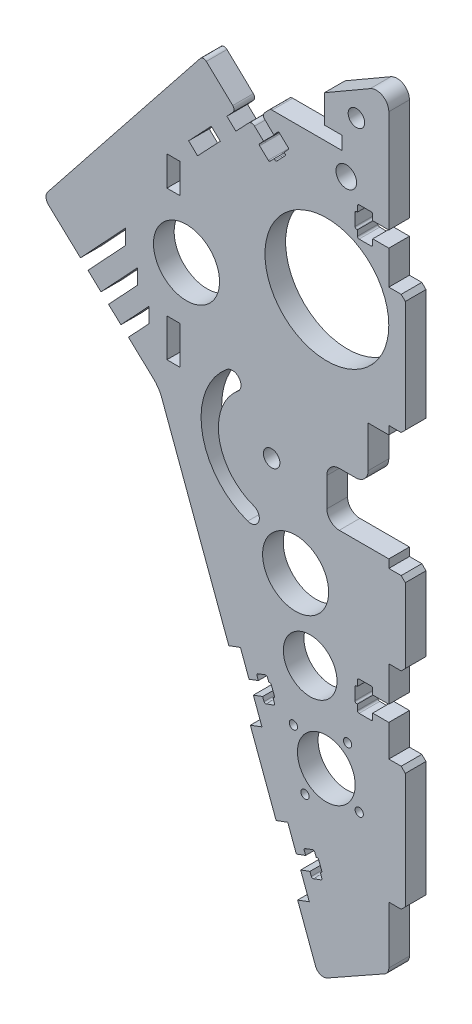
from build123d import *

# Parameters (mm, degrees)
SKETCH_1_R           = 1.5
SKETCH_1_R_2         = 2
SKETCH_1_W           = 3
SKETCH_1_H           = 10
SKETCH_1_H_2         = 7
EXTRUDE_1_DEPTH      = 5
EXTRUDE_2_DEPTH      = 5
SKETCH_3_W           = 3
SKETCH_3_H           = 5
CUT_EXTRUDE_1_DEPTH  = 6
CUT_EXTRUDE_2_DEPTH  = 5
SKETCH_5_W           = 3
SKETCH_5_H           = 5
EXTRUDE_3_DEPTH      = 1
FILLET_1_R           = 1
FILLET_2_R           = 2
FILLET_3_R           = 8
FILLET_4_R           = 0.5
FILLET_5_R           = 0.5
SKETCH_6_R           = 13.9
CUT_EXTRUDE_3_DEPTH  = 5
SKETCH_8_R           = 15
SKETCH_8_R_2         = 13.9
CUT_EXTRUDE_5_DEPTH  = 5
SKETCH_9_W           = 3
SKETCH_9_H           = 5
EXTRUDE_4_DEPTH      = 5
SKETCH_10_R          = 2.5
CUT_EXTRUDE_6_DEPTH  = 7
CUT_EXTRUDE_7_DEPTH  = 7
SKETCH_13_W          = 3
SKETCH_13_H          = 10
CUT_EXTRUDE_9_DEPTH  = 5
CUT_EXTRUDE_11_DEPTH = 102.030456202
SKETCH_16_R          = 1.5
EXTRUDE_5_DEPTH      = 5
SKETCH_17_R          = 10.5
SKETCH_17_R_2        = 2
CUT_EXTRUDE_12_DEPTH = 10
SKETCH_18_W          = 3
SKETCH_18_H          = 10
EXTRUDE_6_DEPTH      = 5
SKETCH_25_R          = 10.5
SKETCH_25_R_2        = 2.5
EXTRUDE_7_DEPTH      = 5
EXTRUDE_8_DEPTH      = 5
SKETCH_28_R          = 8
SKETCH_28_R_2        = 2.5
CUT_EXTRUDE_14_DEPTH = 102.030456202
SKETCH_29_R          = 3
CUT_EXTRUDE_15_DEPTH = 10
SKETCH_32_R          = 2
CUT_EXTRUDE_18_DEPTH = 10
SKETCH_33_R          = 6.5
SKETCH_33_R_2        = 3
CUT_EXTRUDE_19_DEPTH = 10
SKETCH_34_R          = 6.5
SKETCH_34_R_2        = 2
CUT_EXTRUDE_20_DEPTH = 5
SKETCH_35_R          = 1.05
CUT_EXTRUDE_21_DEPTH = 5
SKETCH_36_R          = 2.5
SKETCH_36_R_2        = 1.05
CUT_EXTRUDE_22_DEPTH = 5
SKETCH_37_R          = 2.5
SKETCH_37_R_2        = 2
EXTRUDE_9_DEPTH      = 5
CUT_EXTRUDE_23_DEPTH = 5
SKETCH_39_R          = 8.5
SKETCH_39_R_2        = 6.5
SKETCH_39_R_3        = 8
CUT_EXTRUDE_25_DEPTH = 102.030456202
EXTRUDE_START        = -5
SKETCH_40_R          = 1.5
EXTRUDE_10_DEPTH     = 5
SKETCH_41_R          = 2.5
CUT_EXTRUDE_26_DEPTH = 224.315111886
SKETCH_42_R          = 8.5
EXTRUDE_11_DEPTH     = 5
SKETCH_44_R          = 6.95
CUT_EXTRUDE_28_DEPTH = 10
SKETCH_46_R          = 6.5
CUT_EXTRUDE_29_DEPTH = 10
SKETCH_47_R          = 6.5
SKETCH_47_R_2        = 8
SKETCH_47_R_3        = 7
CUT_EXTRUDE_30_DEPTH = 102.030456202
SKETCH_50_W          = 5
SKETCH_50_H          = 26
CUT_EXTRUDE_31_DEPTH = 10
SKETCH_51_R          = 1
CUT_EXTRUDE_32_DEPTH = 10
CUT_EXTRUDE_33_DEPTH = 5
SKETCH_54_W          = 3
SKETCH_54_H          = 5
EXTRUDE_12_DEPTH     = 2
CUT_EXTRUDE_34_DEPTH = 10
FILLET_8_R           = 3
FILLET_9_R           = 3
CUT_EXTRUDE_35_DEPTH = 5
CUT_EXTRUDE_36_DEPTH = 5
EXTRUDE_13_DEPTH     = 5
SKETCH_59_R          = 2
CUT_EXTRUDE_37_DEPTH = 5
SKETCH_60_W          = 5
SKETCH_60_H          = 29
SKETCH_60_H_2        = 20
SKETCH_60_H_3        = 30
EXTRUDE_14_DEPTH     = 1
CHAMFER_1_SIZE       = 1
SKETCH_61_W          = 4.23427564
SKETCH_61_H          = 5
CUT_EXTRUDE_38_DEPTH = 0.2
SKETCH_63_W          = 3.2
SKETCH_63_H          = 7.2
SKETCH_63_W_2        = 3
SKETCH_63_H_2        = 7
SKETCH_63_H_3        = 9.2
SKETCH_63_H_4        = 9
CUT_EXTRUDE_39_DEPTH = 9
CUT_EXTRUDE_START    = -9
CUT_EXTRUDE_40_DEPTH = 9
SKETCH_65_R          = 6.5
EXTRUDE_15_DEPTH     = 5
SKETCH_66_R          = 6.5
CUT_EXTRUDE_41_DEPTH = 10


with BuildPart() as part:
    # 草图1 → 凸台-拉伸1 (new body)
    with BuildSketch(Plane.XY):
        with BuildLine():
            Line((24.110066786, 85.258646967), (24.110066786, 81.258646967))
            Line((24.110066786, 81.258646967), (25.510066786, 81.258646967))
            ThreePointArc((25.510066786, 81.258646967), (25.72219882, 81.170779001), (25.810066786, 80.958646967))
            Line((25.810066786, 80.958646967), (25.810066786, 78.058646967))
            ThreePointArc((25.810066786, 78.058646967), (25.72219882, 77.846514932), (25.510066786, 77.758646967))
            Line((25.510066786, 77.758646967), (24.060066786, 77.758646967))
            Line((24.060066786, 77.758646967), (24.060066786, 77.458646967))
            ThreePointArc((24.060066786, 77.458646967), (23.97219882, 77.246514932), (23.760066786, 77.158646967))
            Line((23.760066786, 77.158646967), (20.860066786, 77.158646967))
            ThreePointArc((20.860066786, 77.158646967), (20.647934752, 77.246514932), (20.560066786, 77.458646967))
            Line((20.560066786, 77.458646967), (20.560066786, 77.758646967))
            Line((20.560066786, 77.758646967), (19.110066786, 77.758646967))
            ThreePointArc((19.110066786, 77.758646967), (18.897934752, 77.846514932), (18.810066786, 78.058646967))
            Line((18.810066786, 78.058646967), (18.810066786, 80.958646967))
            ThreePointArc((18.810066786, 80.958646967), (18.897934752, 81.170779001), (19.110066786, 81.258646967))
            Line((19.110066786, 81.258646967), (20.510066786, 81.258646967))
            Line((20.510066786, 81.258646967), (20.510066786, 85.258646967))
            Line((20.510066786, 85.258646967), (11.664253751, 85.258646967))
            Line((11.664253751, 85.258646967), (9.598297328, 83.074863264))
            Line((9.598297328, 83.074863264), (12.504028119, 80.325912815))
            Line((12.504028119, 80.325912815), (13.466160776, 81.342918592))
            ThreePointArc((13.466160776, 81.342918592), (13.675776052, 81.436632067), (13.890261869, 81.354677117))
            Line((13.890261869, 81.354677117), (15.996916692, 79.361688042))
            ThreePointArc((15.996916692, 79.361688042), (16.090630167, 79.152072766), (16.008675218, 78.937586949))
            Line((16.008675218, 78.937586949), (15.01218068, 77.884259537))
            Line((15.01218068, 77.884259537), (15.230110489, 77.678088254))
            ThreePointArc((15.230110489, 77.678088254), (15.323823965, 77.468472977), (15.241869015, 77.253987161))
            Line((15.241869015, 77.253987161), (13.24887994, 75.147332337))
            ThreePointArc((13.24887994, 75.147332337), (13.039264663, 75.053618862), (12.824778847, 75.135573812))
            Line((12.824778847, 75.135573812), (12.606849037, 75.341745095))
            Line((12.606849037, 75.341745095), (11.610354499, 74.288417684))
            ThreePointArc((11.610354499, 74.288417684), (11.400739223, 74.194704209), (11.186253406, 74.276659158))
            Line((11.186253406, 74.276659158), (9.079598583, 76.269648234))
            ThreePointArc((9.079598583, 76.269648234), (8.985885108, 76.47926351), (9.067840058, 76.693749327))
            Line((9.067840058, 76.693749327), (10.029972715, 77.710755103))
            Line((10.029972715, 77.710755103), (7.124241924, 80.459705553))
            Line((7.124241924, 80.459705553), (3.33493389, 76.454282671))
            Line((3.33493389, 76.454282671), (1.155635797, 78.515995507))
            Line((1.155635797, 78.515995507), (3.288183972, 80.770168877))
            Line((3.288183972, 80.770168877), (-4.627382992, 88.258646967))
            Line((-4.627382992, 88.258646967), (-43.372617008, 39.51341295))
            Line((-43.372617008, 39.51341295), (-15.278493909, 13.299105295))
            Line((-15.278493909, 13.299105295), (23.442000691, -91.258646967))
            Line((23.442000691, -91.258646967), (40.372617008, -81.741353033))
            Line((40.372617008, -81.741353033), (40.372617008, -66.741353033))
            Line((40.372617008, -66.741353033), (43.372617008, -66.741353033))
            Line((43.372617008, -66.741353033), (43.372617008, -36.741353033))
            Line((43.372617008, -36.741353033), (40.372617008, -36.741353033))
            Line((40.372617008, -36.741353033), (40.372617008, -16.741353033))
            Line((40.372617008, -16.741353033), (43.372617008, -16.741353033))
            Line((43.372617008, -16.741353033), (43.372617008, 3.258646967))
            Line((43.372617008, 3.258646967), (40.372617008, 3.258646967))
            Line((40.372617008, 3.258646967), (40.372617008, 33.258646967))
            Line((40.372617008, 33.258646967), (43.372617008, 33.258646967))
            Line((43.372617008, 33.258646967), (43.372617008, 63.258646967))
            Line((43.372617008, 63.258646967), (40.372617008, 63.258646967))
            Line((40.372617008, 63.258646967), (40.372617008, 91.258646967))
            Line((40.372617008, 91.258646967), (26.01843538, 89.258646967))
            Line((26.01843538, 89.258646967), (26.01843538, 88.258646967))
            Line((26.01843538, 88.258646967), (29.01843538, 88.258646967))
            Line((29.01843538, 88.258646967), (29.01843538, 85.258646967))
            Line((29.01843538, 85.258646967), (24.110066786, 85.258646967))
        make_face()
        with Locations((-0.627382992, 42.90511504)):
            Circle(SKETCH_1_R, mode=Mode.SUBTRACT)
        with Locations((-16.627382992, 42.90511504)):
            Circle(SKETCH_1_R, mode=Mode.SUBTRACT)
        with Locations((-8.627382992, 42.90511504)):
            Circle(SKETCH_1_R_2, mode=Mode.SUBTRACT)
        with Locations((-8.627382992, 33.40511504)):
            Circle(SKETCH_1_R, mode=Mode.SUBTRACT)
        with Locations((-8.627382992, 52.40511504)):
            Circle(SKETCH_1_R, mode=Mode.SUBTRACT)
        with Locations((-3.334138896, -7.554104516)):
            Circle(SKETCH_1_R, mode=Mode.SUBTRACT)
        with Locations((17.428516218, -66.946668999)):
            Circle(SKETCH_1_R, mode=Mode.SUBTRACT)
        with Locations((7.903198422, -39.393226917)):
            Circle(SKETCH_1_R, mode=Mode.SUBTRACT)
        with Locations((-11.778493909, 25.258646967)):
            Rectangle(SKETCH_1_W, SKETCH_1_H, mode=Mode.SUBTRACT)
        with Locations((-11.778493909, 59.758646967)):
            Rectangle(SKETCH_1_W, SKETCH_1_H_2, mode=Mode.SUBTRACT)
        Polygon((0.058370516, 10.169444748), (8.447755551, 4.727182468), (6.815076867, 2.210366957), (-1.574308168, 7.652629238), align=None, mode=Mode.SUBTRACT)
        Polygon((31.983231973, -14.116419884), (19.39915442, -5.953026463), (21.031833104, -3.436210953), (33.615910657, -11.599604373), align=None, mode=Mode.SUBTRACT)
        with BuildLine():
            Line((31.674388164, 21.897928134), (31.674388164, -0.348192949))
            ThreePointArc((31.674388164, -0.348192949), (30.106513149, -2.984291966), (27.04170948, -2.86500846))
            Line((27.04170948, -2.86500846), (3.74702829, 12.24644062))
            ThreePointArc((3.74702829, 12.24644062), (2.743607957, 13.331131145), (2.379706974, 14.763256131))
            Line((2.379706974, 14.763256131), (2.379706974, 24.319098404))
            ThreePointArc((2.379706974, 24.319098404), (3.5219981, 26.674712494), (6.078985468, 27.236461869))
            Line((6.078985468, 27.236461869), (23.008916273, 23.178435961))
            ThreePointArc((23.008916273, 23.178435961), (24.06434878, 23.117015392), (25.075550509, 23.4255301))
            Line((25.075550509, 23.4255301), (27.307032423, 24.568197461))
            ThreePointArc((27.307032423, 24.568197461), (30.239305538, 24.457426838), (31.674388164, 21.897928134))
        make_face(mode=Mode.SUBTRACT)
    extrude(amount=EXTRUDE_1_DEPTH)

    # 草图2 → 凸台-拉伸2 (add)
    with BuildSketch(Plane.XY.offset(5)):
        Polygon((16.087160268, 85.258646967), (19.940350763, 70.440732915), (29.778501441, 72.999005864), (25.938529583, 85.258646967), align=None)
    extrude(amount=-EXTRUDE_2_DEPTH)

    # 草图3 → 切除-拉伸1 (cut)
    with BuildSketch(Plane(origin=(0, 63.258646967, 0), x_dir=(1, 0, 0), z_dir=(0, 1, 0))):
        with Locations((41.872617008, -2.5)):
            Rectangle(SKETCH_3_W, SKETCH_3_H)
    extrude(amount=-CUT_EXTRUDE_1_DEPTH, mode=Mode.SUBTRACT)

    # 草图4 → 切除-拉伸2 (cut)
    with BuildSketch(Plane(origin=(247.872617008, 71.662583046, 0), x_dir=(-1, 0, 0), z_dir=(0, 0, -1))):
        with BuildLine():
            Line((211.5, -1.116596528), (211.5, -2.516596528))
            ThreePointArc((211.5, -2.516596528), (211.587867966, -2.728728563), (211.8, -2.816596528))
            Line((211.8, -2.816596528), (214.7, -2.816596528))
            ThreePointArc((214.7, -2.816596528), (214.912132034, -2.728728563), (215, -2.516596528))
            Line((215, -2.516596528), (215, -1.066596528))
            Line((215, -1.066596528), (215.3, -1.066596528))
            ThreePointArc((215.3, -1.066596528), (215.512132034, -0.978728563), (215.6, -0.766596528))
            Line((215.6, -0.766596528), (215.6, 2.133403472))
            ThreePointArc((215.6, 2.133403472), (215.512132034, 2.345535506), (215.3, 2.433403472))
            Line((215.3, 2.433403472), (215, 2.433403472))
            Line((215, 2.433403472), (215, 3.883403472))
            ThreePointArc((215, 3.883403472), (214.912132034, 4.095535506), (214.7, 4.183403472))
            Line((214.7, 4.183403472), (211.8, 4.183403472))
            ThreePointArc((211.8, 4.183403472), (211.587867966, 4.095535506), (211.5, 3.883403472))
            Line((211.5, 3.883403472), (211.5, 2.483403472))
            Line((211.5, 2.483403472), (207.5, 2.483403472))
            Line((207.5, 2.483403472), (207.5, -1.116596528))
            Line((207.5, -1.116596528), (211.5, -1.116596528))
        make_face()
        with BuildLine():
            Line((215, -102.00737607), (215, -100.55737607))
            Line((215, -100.55737607), (215.3, -100.55737607))
            ThreePointArc((215.3, -100.55737607), (215.512132034, -100.469508105), (215.6, -100.25737607))
            Line((215.6, -100.25737607), (215.6, -97.35737607))
            ThreePointArc((215.6, -97.35737607), (215.512132034, -97.145244036), (215.3, -97.05737607))
            Line((215.3, -97.05737607), (215, -97.05737607))
            Line((215, -97.05737607), (215, -95.60737607))
            ThreePointArc((215, -95.60737607), (214.912132034, -95.395244036), (214.7, -95.30737607))
            Line((214.7, -95.30737607), (211.8, -95.30737607))
            ThreePointArc((211.8, -95.30737607), (211.587867966, -95.395244036), (211.5, -95.60737607))
            Line((211.5, -95.60737607), (211.5, -97.00737607))
            Line((211.5, -97.00737607), (207.5, -97.00737607))
            Line((207.5, -97.00737607), (207.5, -100.60737607))
            Line((207.5, -100.60737607), (211.5, -100.60737607))
            Line((211.5, -100.60737607), (211.5, -102.00737607))
            ThreePointArc((211.5, -102.00737607), (211.587867966, -102.219508105), (211.8, -102.30737607))
            Line((211.8, -102.30737607), (214.7, -102.30737607))
            ThreePointArc((214.7, -102.30737607), (214.912132034, -102.219508105), (215, -102.00737607))
        make_face()
    extrude(amount=-CUT_EXTRUDE_2_DEPTH, mode=Mode.SUBTRACT)

    # 草图5 → 凸台-拉伸3 (add)
    with BuildSketch(Plane.XZ.offset(-30.258646967)):
        with Locations((-11.778493909, 2.5)):
            Rectangle(SKETCH_5_W, SKETCH_5_H)
    extrude(amount=EXTRUDE_3_DEPTH)

    # 圆角1
    fillet_1_edges = [part.edges().sort_by_distance(p)[0] for p in [
        (40.372617008, 91.258646967, 2.5),
        (-4.627382992, 88.258646967, 2.5),
        (3.288183972, 80.770168877, 2.5),
        (7.124241924, 80.459705553, 2.5),
        (9.598297328, 83.074863264, 2.5),
        (11.664253751, 85.258646967, 2.5),
    ]]
    fillet(fillet_1_edges, radius=FILLET_1_R)

    # 圆角2
    fillet_2_edges = [part.edges().sort_by_distance(p)[0] for p in [
        (40.372617008, -81.741353033, 2.5),
        (23.442000691, -91.258646967, 2.5),
        (-43.372617008, 39.51341295, 2.5),
    ]]
    fillet(fillet_2_edges, radius=FILLET_2_R)

    # 圆角3
    fillet_3_edges = [part.edges().sort_by_distance(p)[0] for p in [
        (-15.278493909, 13.299105295, 2.5),
    ]]
    fillet(fillet_3_edges, radius=FILLET_3_R)

    # 圆角4
    fillet_4_edges = [part.edges().sort_by_distance(p)[0] for p in [
        (26.01843538, 88.258646967, 2.5),
    ]]
    fillet(fillet_4_edges, radius=FILLET_4_R)

    # 圆角5
    fillet_5_edges = [part.edges().sort_by_distance(p)[0] for p in [
        (26.01843538, 89.258646967, 2.5),
    ]]
    fillet(fillet_5_edges, radius=FILLET_5_R)

    # 草图6 → 切除-拉伸3 (cut)
    with BuildSketch(Plane(origin=(151.993359174, -9.113805438, 5), x_dir=(1, 0, 0), z_dir=(0, 0, 1))):
        with Locations((-126.620742166, 63.372452405)):
            Circle(SKETCH_6_R)
    extrude(amount=-CUT_EXTRUDE_3_DEPTH, mode=Mode.SUBTRACT)

    # 草图8 → 切除-拉伸5 (cut)
    with BuildSketch(Plane.XY.offset(5)):
        with Locations((25.372617008, 54.258646967)):
            Circle(SKETCH_8_R)
        with Locations((25.372617008, 54.258646967)):
            Circle(SKETCH_8_R_2, mode=Mode.SUBTRACT)
    extrude(amount=-CUT_EXTRUDE_5_DEPTH, mode=Mode.SUBTRACT)

    # 草图9 → 凸台-拉伸4 (add)
    with BuildSketch(Plane(origin=(0, 57.258646967, 0), x_dir=(1, 0, 0), z_dir=(0, 1, 0))):
        with Locations((41.872617008, -2.5)):
            Rectangle(SKETCH_9_W, SKETCH_9_H)
    extrude(amount=EXTRUDE_4_DEPTH)

    # 草图10 → 切除-拉伸6 (cut)
    with BuildSketch(Plane.XY.offset(5)):
        with Locations((-3.086107777, 36.571790662)):
            Circle(SKETCH_10_R)
    extrude(amount=-CUT_EXTRUDE_6_DEPTH, mode=Mode.SUBTRACT)

    # 草图11 → 切除-拉伸7 (cut)
    with BuildSketch(Plane(origin=(151.993359174, -9.113805438, 0), x_dir=(-1, 0, 0), z_dir=(0, 0, -1))):
        Polygon((186.315755954, 40.18256053), (175.400193761, 51.880872459), (175.400193761, 48.216379574), (184.487894715, 38.477003937), align=None)
        Polygon((181.336500663, 35.536473886), (172.467606381, 45.041352329), (172.467606381, 41.376859443), (179.508639424, 33.830917294), align=None)
        Polygon((174.688206133, 29.333025657), (169.693841001, 34.68553432), (169.693841001, 38.350027206), (176.516067372, 31.03858225), align=None)
    extrude(amount=-CUT_EXTRUDE_7_DEPTH, mode=Mode.SUBTRACT)

    # 草图13 → 切除-拉伸9 (cut)
    with BuildSketch(Plane(origin=(151.993359174, -9.113805438, 5), x_dir=(1, 0, 0), z_dir=(0, 0, 1))):
        with Locations((-131.120742166, -13.297143687)):
            Rectangle(SKETCH_13_W, SKETCH_13_H)
        with Locations((-131.120742166, -34.297143687)):
            Rectangle(SKETCH_13_W, SKETCH_13_H)
    extrude(amount=-CUT_EXTRUDE_9_DEPTH, mode=Mode.SUBTRACT)

    # 草图15 → 切除-拉伸11 (cut, through all)
    with BuildSketch(Plane(origin=(0, 0, 0), x_dir=(-1, 0, 0), z_dir=(0, 0, -1))):
        with BuildLine():
            Line((1.38875013, 38.407267989), (-2.408722843, 34.895554883))
            ThreePointArc((-2.408722843, 34.895554883), (-2.074657304, 29.412918204), (3.232514572, 30.828838897))
            Line((3.232514572, 30.828838897), (5.363967741, 35.541570304))
            ThreePointArc((5.363967741, 35.541570304), (4.548059056, 38.599769572), (1.38875013, 38.407267989))
        make_face()
    extrude(amount=-CUT_EXTRUDE_11_DEPTH, mode=Mode.SUBTRACT)

    # 草图16 → 凸台-拉伸5 (add)
    with BuildSketch(Plane(origin=(0, 0, 0), x_dir=(-1, 0, 0), z_dir=(0, 0, -1))):
        with Locations((8.627382992, 52.40511504)):
            Circle(SKETCH_16_R)
        with Locations((16.627382992, 42.90511504)):
            Circle(SKETCH_16_R)
        with Locations((0.627382992, 42.90511504)):
            Circle(SKETCH_16_R)
        with Locations((8.627382992, 33.40511504)):
            Circle(SKETCH_16_R)
        with BuildLine():
            Line((1.38875013, 38.407267989), (-2.408722843, 34.895554883))
            ThreePointArc((-2.408722843, 34.895554883), (-2.074657304, 29.412918204), (3.232514572, 30.828838897))
            Line((3.232514572, 30.828838897), (5.363967741, 35.541570304))
            ThreePointArc((5.363967741, 35.541570304), (4.548059056, 38.599769572), (1.38875013, 38.407267989))
        make_face()
        with BuildLine():
            Line((-2.379706974, 24.319098404), (-2.379706974, 14.763256131))
            ThreePointArc((-2.379706974, 14.763256131), (-2.743607957, 13.331131145), (-3.74702829, 12.24644062))
            Line((-3.74702829, 12.24644062), (-27.04170948, -2.86500846))
            ThreePointArc((-27.04170948, -2.86500846), (-30.106513149, -2.984291966), (-31.674388164, -0.348192949))
            Line((-31.674388164, -0.348192949), (-31.674388164, 21.897928134))
            ThreePointArc((-31.674388164, 21.897928134), (-30.239305538, 24.457426838), (-27.307032423, 24.568197461))
            Line((-27.307032423, 24.568197461), (-25.075550509, 23.4255301))
            ThreePointArc((-25.075550509, 23.4255301), (-24.06434878, 23.117015392), (-23.008916273, 23.178435961))
            Line((-23.008916273, 23.178435961), (-6.078985468, 27.236461869))
            ThreePointArc((-6.078985468, 27.236461869), (-3.5219981, 26.674712494), (-2.379706974, 24.319098404))
        make_face()
    extrude(amount=-EXTRUDE_5_DEPTH)

    # 草图17 → 切除-拉伸12 (cut)
    with BuildSketch(Plane(origin=(0, 0, 0), x_dir=(-1, 0, 0), z_dir=(0, 0, -1))):
        with Locations((8.627382992, 42.90511504)):
            Circle(SKETCH_17_R)
        with Locations((8.627382992, 42.90511504)):
            Circle(SKETCH_17_R_2, mode=Mode.SUBTRACT)
    extrude(amount=-CUT_EXTRUDE_12_DEPTH, mode=Mode.SUBTRACT)

    # 草图18 → 凸台-拉伸6 (add)
    with BuildSketch(Plane(origin=(0, 0, 0), x_dir=(-1, 0, 0), z_dir=(0, 0, -1))):
        with Locations((-20.872617008, -22.410949125)):
            Rectangle(SKETCH_18_W, SKETCH_18_H)
        with Locations((-20.872617008, -43.410949125)):
            Rectangle(SKETCH_18_W, SKETCH_18_H)
    extrude(amount=-EXTRUDE_6_DEPTH)

    # 草图25 → 凸台-拉伸7 (add)
    with BuildSketch(Plane(origin=(0, 0, 0), x_dir=(-1, 0, 0), z_dir=(0, 0, -1))):
        with Locations((8.627382992, 42.90511504)):
            Circle(SKETCH_25_R)
        with Locations((8.627382992, 42.90511504)):
            Circle(SKETCH_25_R_2, mode=Mode.SUBTRACT)
    extrude(amount=-EXTRUDE_7_DEPTH)

    # 草图26 → 凸台-拉伸8 (add)
    with BuildSketch(Plane.XY.offset(5)):
        Polygon((19.39915442, -5.953026463), (31.983231973, -14.116419884), (33.615910657, -11.599604373), (21.031833104, -3.436210953), align=None)
        Polygon((8.447755551, 4.727182468), (0.058370516, 10.169444748), (-1.574308168, 7.652629238), (6.815076867, 2.210366957), align=None)
    extrude(amount=-EXTRUDE_8_DEPTH)

    # 草图28 → 切除-拉伸14 (cut, through all)
    with BuildSketch(Plane(origin=(0, 0, 0), x_dir=(-1, 0, 0), z_dir=(0, 0, -1))):
        with Locations((8.627382992, 42.90511504)):
            Circle(SKETCH_28_R)
        with Locations((8.627382992, 42.90511504)):
            Circle(SKETCH_28_R_2, mode=Mode.SUBTRACT)
    extrude(amount=-CUT_EXTRUDE_14_DEPTH, mode=Mode.SUBTRACT)

    # 草图29 → 切除-拉伸15 (cut)
    with BuildSketch(Plane(origin=(151.993359174, -9.113805438, 5), x_dir=(1, 0, 0), z_dir=(0, 0, 1))):
        with Locations((-128.473440751, -29.371661781)):
            Circle(SKETCH_29_R)
    extrude(amount=-CUT_EXTRUDE_15_DEPTH, mode=Mode.SUBTRACT)

    # 草图32 → 切除-拉伸18 (cut)
    with BuildSketch(Plane(origin=(151.993359174, -9.113805438, 5), x_dir=(1, 0, 0), z_dir=(0, 0, 1))):
        with Locations((-134.195557296, 0.077572203)):
            Circle(SKETCH_32_R)
    extrude(amount=-CUT_EXTRUDE_18_DEPTH, mode=Mode.SUBTRACT)

    # 草图33 → 切除-拉伸19 (cut)
    with BuildSketch(Plane.XY.offset(5)):
        with Locations((23.519918423, -38.48546722)):
            Circle(SKETCH_33_R)
        with Locations((23.519918423, -38.48546722)):
            Circle(SKETCH_33_R_2, mode=Mode.SUBTRACT)
    extrude(amount=-CUT_EXTRUDE_19_DEPTH, mode=Mode.SUBTRACT)

    # 草图34 → 切除-拉伸20 (cut)
    with BuildSketch(Plane.XY.offset(5)):
        with Locations((17.797801879, -9.036233236)):
            Circle(SKETCH_34_R)
        with Locations((17.797801879, -9.036233236)):
            Circle(SKETCH_34_R_2, mode=Mode.SUBTRACT)
    extrude(amount=-CUT_EXTRUDE_20_DEPTH, mode=Mode.SUBTRACT)

    # 草图35 → 切除-拉伸21 (cut)
    with BuildSketch(Plane(origin=(151.993359174, -9.113805438, 5), x_dir=(1, 0, 0), z_dir=(0, 0, 1))):
        with Locations((-139.999477336, 21.298187467)):
            Circle(SKETCH_35_R)
        with BuildLine():
            ThreePointArc((-148.576396049, 31.723467577), (-153.301600913, 18.995252745), (-144.572500517, 8.59631914))
            ThreePointArc((-144.572500517, 8.59631914), (-143.669295501, 6.67688675), (-145.588727891, 5.773681734))
            ThreePointArc((-145.588727891, 5.773681734), (-156.257628375, 18.483489473), (-150.482377985, 34.040196491))
            ThreePointArc((-150.482377985, 34.040196491), (-148.37102256, 33.834823002), (-148.576396049, 31.723467577))
        make_face()
    extrude(amount=-CUT_EXTRUDE_21_DEPTH, mode=Mode.SUBTRACT)

    # 草图36 → 切除-拉伸22 (cut)
    with BuildSketch(Plane.XY.offset(5)):
        with Locations((11.993881839, 12.184382028)):
            Circle(SKETCH_36_R)
        with Locations((11.993881839, 12.184382028)):
            Circle(SKETCH_36_R_2, mode=Mode.SUBTRACT)
    extrude(amount=-CUT_EXTRUDE_22_DEPTH, mode=Mode.SUBTRACT)

    # 草图37 → 凸台-拉伸9 (add)
    with BuildSketch(Plane.XY.offset(5)):
        with Locations((11.993881839, 12.184382028)):
            Circle(SKETCH_37_R)
        with Locations((11.993881839, 12.184382028)):
            Circle(SKETCH_37_R_2, mode=Mode.SUBTRACT)
    extrude(amount=-EXTRUDE_9_DEPTH)

    # 草图38 → 切除-拉伸23 (cut)
    with BuildSketch(Plane.XY.offset(5)):
        with BuildLine():
            ThreePointArc((3.734626782, 22.223540653), (-0.815570495, 9.966741185), (7.590229886, -0.047046731))
            ThreePointArc((7.590229886, -0.047046731), (8.794503241, -2.606289917), (6.235260055, -3.810563272))
            ThreePointArc((6.235260055, -3.810563272), (-4.756940444, 9.284390156), (1.193317533, 25.312512538))
            ThreePointArc((1.193317533, 25.312512538), (4.0084581, 25.03868122), (3.734626782, 22.223540653))
        make_face()
        with BuildLine():
            ThreePointArc((3.416963125, 22.609662139), (-1.308241739, 9.881447306), (7.420858657, -0.517486298))
            ThreePointArc((7.420858657, -0.517486298), (8.324063673, -2.436918688), (6.404631284, -3.340123704))
            ThreePointArc((6.404631284, -3.340123704), (-4.2642692, 9.369684035), (1.510981189, 24.926391053))
            ThreePointArc((1.510981189, 24.926391053), (3.622336614, 24.721017564), (3.416963125, 22.609662139))
        make_face(mode=Mode.SUBTRACT)
    extrude(amount=-CUT_EXTRUDE_23_DEPTH, mode=Mode.SUBTRACT)

    # 草图39 → 切除-拉伸25 (cut, through all)
    # profile 1 of 2: a face of its own
    with BuildSketch(Plane.XY.offset(5)):
        with Locations((23.519918423, -38.48546722)):
            Circle(SKETCH_39_R)
        with Locations((23.519918423, -38.48546722)):
            Circle(SKETCH_39_R_2, mode=Mode.SUBTRACT)
    # profile 2 of 2: a face of its own
    with BuildSketch(Plane.XY.offset(5)):
        with Locations((17.797801879, -9.036233236)):
            Circle(SKETCH_39_R_3)
        with Locations((17.797801879, -9.036233236)):
            Circle(SKETCH_39_R_2, mode=Mode.SUBTRACT)
    extrude(amount=-CUT_EXTRUDE_25_DEPTH, mode=Mode.SUBTRACT)

    # 草图40 → 凸台-拉伸10 (add)
    with BuildSketch(Plane.XY.offset(5).offset(EXTRUDE_START)):
        with Locations((17.428516218, -66.946668999)):
            Circle(SKETCH_40_R)
        with Locations((7.903198422, -39.393226917)):
            Circle(SKETCH_40_R)
        with Locations((-3.334138896, -7.554104516)):
            Circle(SKETCH_40_R)
    extrude(amount=EXTRUDE_10_DEPTH)

    # 草图41 → 切除-拉伸26 (cut, through all)
    with BuildSketch(Plane(origin=(151.993359174, -9.113805438, -39), x_dir=(-1, 0, 0), z_dir=(0, 0, -1))):
        with Locations(Location((121.921700009, 89.398624841, 0), (0, 0, 90))):
            Circle(SKETCH_41_R)
    extrude(amount=-CUT_EXTRUDE_26_DEPTH, mode=Mode.SUBTRACT)

    # 草图42 → 凸台-拉伸11 (add)
    with BuildSketch(Plane.XY.offset(5)):
        with Locations((23.519918423, -38.48546722)):
            Circle(SKETCH_42_R)
    extrude(amount=-EXTRUDE_11_DEPTH)

    # 草图44 → 切除-拉伸28 (cut)
    with BuildSketch(Plane(origin=(151.993359174, -9.113805438, 5), x_dir=(1, 0, 0), z_dir=(0, 0, 1))):
        with Locations((-126.757745003, -37.187410667)):
            Circle(SKETCH_44_R)
    extrude(amount=-CUT_EXTRUDE_28_DEPTH, mode=Mode.SUBTRACT)

    # 草图46 → 切除-拉伸29 (cut)
    with BuildSketch(Plane.XY.offset(5)):
        with Locations((22.103903732, -30.610697002)):
            Circle(SKETCH_46_R)
    extrude(amount=-CUT_EXTRUDE_29_DEPTH, mode=Mode.SUBTRACT)

    # 草图47 → 切除-拉伸30 (cut, through all)
    with BuildSketch(Plane.XY.offset(5)):
        with Locations((22.103903732, -30.610697002)):
            Circle(SKETCH_47_R)
        with Locations((17.797801879, -9.036233236)):
            Circle(SKETCH_47_R_2)
        with Locations((25.235614172, -46.301216105)):
            Circle(SKETCH_47_R_3)
    extrude(amount=-CUT_EXTRUDE_30_DEPTH, mode=Mode.SUBTRACT)

    # 草图50 → 切除-拉伸31 (cut)
    with BuildSketch(Plane(origin=(151.993359174, -9.113805438, 0), x_dir=(-1, 0, 0), z_dir=(0, 0, -1))):
        with Locations((114.120742166, 27.372452405)):
            Rectangle(SKETCH_50_W, SKETCH_50_H)
    extrude(amount=-CUT_EXTRUDE_31_DEPTH, mode=Mode.SUBTRACT)

    # 草图51 → 切除-拉伸32 (cut)
    with BuildSketch(Plane(origin=(151.993359174, -9.113805438, 5), x_dir=(1, 0, 0), z_dir=(0, 0, 1))):
        with Locations((-131.915363599, -45.165441152)):
            Circle(SKETCH_51_R)
        with Locations((-134.735775488, -32.029792071)):
            Circle(SKETCH_51_R)
        with Locations((-118.779714518, -42.345029263)):
            Circle(SKETCH_51_R)
        with Locations((-121.600126407, -29.209380182)):
            Circle(SKETCH_51_R)
    extrude(amount=-CUT_EXTRUDE_32_DEPTH, mode=Mode.SUBTRACT)

    # 草图52 → 切除-拉伸33 (cut)
    with BuildSketch(Plane(origin=(151.993359174, -9.113805438, 0), x_dir=(-1, 0, 0), z_dir=(0, 0, -1))):
        Polygon((154.617530245, 83.634421108), (152.438232152, 81.572708272), (159.310608275, 74.308381295), (161.489906368, 76.370094132), align=None)
    extrude(amount=-CUT_EXTRUDE_33_DEPTH, mode=Mode.SUBTRACT)

    # 草图54 → 凸台-拉伸12 (add)
    with BuildSketch(Plane(origin=(29.091306107, 30.750464755, 0), x_dir=(0.7264326976879513, -0.6872376122781739, 0), z_dir=(0.6872376122781739, 0.7264326976879513, 0))):
        with Locations((-51.619653649, -2.5)):
            Rectangle(SKETCH_54_W, SKETCH_54_H)
    extrude(amount=EXTRUDE_12_DEPTH)

    # 草图55 → 切除-拉伸34 (cut)
    with BuildSketch(Plane(origin=(0, 0, 0), x_dir=(-1, 0, 0), z_dir=(0, 0, -1))):
        Polygon((-35.372617008, 5.258646967), (-25.372617008, 5.258646967), (-25.372617008, 17.258646967), (-25.372617008, 18.258646967), (-35.372617008, 18.258646967), align=None)
    extrude(amount=-CUT_EXTRUDE_34_DEPTH, mode=Mode.SUBTRACT)

    # 圆角8
    fillet_8_edges = [part.edges().sort_by_distance(p)[0] for p in [
        (25.372617008, 18.258646967, 2.5),
        (25.372617008, 5.258646967, 2.5),
    ]]
    fillet(fillet_8_edges, radius=FILLET_8_R)

    # 圆角9
    fillet_9_edges = [part.edges().sort_by_distance(p)[0] for p in [
        (35.372617008, 18.258646967, 2.5),
    ]]
    fillet(fillet_9_edges, radius=FILLET_9_R)

    # 草图56 → 切除-拉伸35 (cut)
    with BuildSketch(Plane(origin=(151.993359174, -9.113805438, 5), x_dir=(1, 0, 0), z_dir=(0, 0, 1))):
        Polygon((-133.702985533, -68.233796478), (-130.889698952, -67.191962223), (-136.098870224, -53.125529319), (-138.912156804, -54.167363573), align=None)
        Polygon((-145.163162331, -37.287644088), (-142.34987575, -36.245809833), (-147.559047022, -22.179376929), (-150.372333602, -23.221211183), align=None)
    extrude(amount=-CUT_EXTRUDE_35_DEPTH, mode=Mode.SUBTRACT)

    # 草图57 → 切除-拉伸36 (cut)
    with BuildSketch(Plane(origin=(151.993359174, -9.113805438, 5), x_dir=(1, 0, 0), z_dir=(0, 0, 1))):
        with BuildLine():
            Line((-130.663689785, -60.60341763), (-133.008095269, -61.471612842))
            Line((-133.008095269, -61.471612842), (-133.980473906, -58.8458787))
            Line((-133.980473906, -58.8458787), (-131.636068422, -57.977683488))
            Line((-131.636068422, -57.977683488), (-132.000710411, -56.993033185))
            ThreePointArc((-132.000710411, -56.993033185), (-131.991979962, -56.763589164), (-131.823565179, -56.607521101))
            Line((-131.823565179, -56.607521101), (-130.041817011, -55.94769274))
            ThreePointArc((-130.041817011, -55.94769274), (-129.81237299, -55.95642319), (-129.656304927, -56.124837973))
            Line((-129.656304927, -56.124837973), (-129.274299034, -57.156376386))
            Line((-129.274299034, -57.156376386), (-129.086746595, -57.086920769))
            ThreePointArc((-129.086746595, -57.086920769), (-128.857302574, -57.095651218), (-128.701234512, -57.264066001))
            Line((-128.701234512, -57.264066001), (-127.971950534, -59.233366608))
            ThreePointArc((-127.971950534, -59.233366608), (-127.980680983, -59.462810629), (-128.149095766, -59.618878692))
            Line((-128.149095766, -59.618878692), (-128.336648205, -59.688334309))
            Line((-128.336648205, -59.688334309), (-127.954642312, -60.719872722))
            ThreePointArc((-127.954642312, -60.719872722), (-127.963372761, -60.949316742), (-128.131787544, -61.105384805))
            Line((-128.131787544, -61.105384805), (-129.913535712, -61.765213166))
            ThreePointArc((-129.913535712, -61.765213166), (-130.142979733, -61.756482717), (-130.299047796, -61.588067934))
            Line((-130.299047796, -61.588067934), (-130.663689785, -60.60341763))
        make_face()
        with BuildLine():
            Line((-142.123866583, -29.65726524), (-144.468272067, -30.525460452))
            Line((-144.468272067, -30.525460452), (-145.440650704, -27.89972631))
            Line((-145.440650704, -27.89972631), (-143.09624522, -27.031531098))
            Line((-143.09624522, -27.031531098), (-143.460887209, -26.046880794))
            ThreePointArc((-143.460887209, -26.046880794), (-143.45215676, -25.817436774), (-143.283741977, -25.661368711))
            Line((-143.283741977, -25.661368711), (-141.501993809, -25.00154035))
            ThreePointArc((-141.501993809, -25.00154035), (-141.272549788, -25.010270799), (-141.116481725, -25.178685582))
            Line((-141.116481725, -25.178685582), (-140.734475832, -26.210223995))
            Line((-140.734475832, -26.210223995), (-140.546923393, -26.140768379))
            ThreePointArc((-140.546923393, -26.140768379), (-140.317479372, -26.149498828), (-140.16141131, -26.317913611))
            Line((-140.16141131, -26.317913611), (-139.432127332, -28.287214218))
            ThreePointArc((-139.432127332, -28.287214218), (-139.440857781, -28.516658239), (-139.609272564, -28.672726301))
            Line((-139.609272564, -28.672726301), (-139.796825003, -28.742181918))
            Line((-139.796825003, -28.742181918), (-139.41481911, -29.773720331))
            ThreePointArc((-139.41481911, -29.773720331), (-139.423549559, -30.003164352), (-139.591964342, -30.159232415))
            Line((-139.591964342, -30.159232415), (-141.37371251, -30.819060776))
            ThreePointArc((-141.37371251, -30.819060776), (-141.603156531, -30.810330326), (-141.759224594, -30.641915543))
            Line((-141.759224594, -30.641915543), (-142.123866583, -29.65726524))
        make_face()
    extrude(amount=-CUT_EXTRUDE_36_DEPTH, mode=Mode.SUBTRACT)

    # 草图58 → 凸台-拉伸13 (add)
    with BuildSketch(Plane(origin=(0, 0, 0), x_dir=(-1, 0, 0), z_dir=(0, 0, -1))):
        Polygon((-40.372617008, 90.109654671), (-40.372617008, 113.720582355), (-17.846708878, 113.720582355), (-17.846708878, 88.258646967), (-29.01843538, 88.258646967), (-40.372617008, 88.258646967), align=None)
    extrude(amount=-EXTRUDE_13_DEPTH)

    # 草图59 → 切除-拉伸37 (cut)
    with BuildSketch(Plane(origin=(151.993359174, -9.113805438, 0), x_dir=(-1, 0, 0), z_dir=(0, 0, -1))):
        with Locations((119.468439353, 102.928528754)):
            Circle(SKETCH_59_R)
        with BuildLine():
            Line((127.209199434, 104.372452405), (127.209199434, 97.372452405))
            Line((127.209199434, 97.372452405), (134.146650297, 97.372452405))
            Line((134.146650297, 97.372452405), (134.146650297, 122.834387793))
            Line((134.146650297, 122.834387793), (111.620742166, 122.834387793))
            Line((111.620742166, 122.834387793), (111.620742166, 108.176299982))
            ThreePointArc((111.620742166, 108.176299982), (113.120742166, 110.774376194), (116.120742166, 110.774376194))
            Line((116.120742166, 110.774376194), (127.209199434, 104.372452405))
        make_face()
    extrude(amount=-CUT_EXTRUDE_37_DEPTH, mode=Mode.SUBTRACT)

    # 草图60 → 凸台-拉伸14 (add)
    with BuildSketch(Plane(origin=(43.372617008, 0, 0), x_dir=(0, 0, -1), z_dir=(1, 0, 0))):
        with Locations((-2.5, 47.758646967)):
            Rectangle(SKETCH_60_W, SKETCH_60_H)
        with Locations((-2.5, -6.741353033)):
            Rectangle(SKETCH_60_W, SKETCH_60_H_2)
        with Locations((-2.5, -51.741353033)):
            Rectangle(SKETCH_60_W, SKETCH_60_H_3)
    extrude(amount=EXTRUDE_14_DEPTH)

    # 倒角1
    chamfer_1_edges = [part.edges().sort_by_distance(p)[0] for p in [
        (44.372617008, 33.258646967, 2.5),
        (44.372617008, 62.258646967, 2.5),
        (44.372617008, -16.741353033, 2.5),
        (44.372617008, 3.258646967, 2.5),
        (44.372617008, -66.741353033, 2.5),
        (44.372617008, -36.741353033, 2.5),
    ]]
    chamfer(chamfer_1_edges, length=CHAMFER_1_SIZE)

    # 草图61 → 切除-拉伸38 (cut)
    with BuildSketch(Plane.XZ.offset(-88.258646967)):
        with Locations((26.90129756, 2.5)):
            Rectangle(SKETCH_61_W, SKETCH_61_H)
    extrude(amount=-CUT_EXTRUDE_38_DEPTH, mode=Mode.SUBTRACT)

    # 草图63 → 切除-拉伸39 (cut)
    # profile 1 of 5: a face of its own
    with BuildSketch(Plane(origin=(0, 0, 0), x_dir=(-1, 0, 0), z_dir=(0, 0, -1))):
        with BuildLine():
            Line((-32.872617008, 74.095986517), (-32.872617008, 75.545986517))
            ThreePointArc((-32.872617008, 75.545986517), (-32.960484974, 75.758118552), (-33.172617008, 75.845986517))
            Line((-33.172617008, 75.845986517), (-36.072617008, 75.845986517))
            ThreePointArc((-36.072617008, 75.845986517), (-36.284749043, 75.758118552), (-36.372617008, 75.545986517))
            Line((-36.372617008, 75.545986517), (-36.372617008, 74.145986517))
            Line((-36.372617008, 74.145986517), (-40.372617008, 74.145986517))
            Line((-40.372617008, 74.145986517), (-40.372617008, 74.245986517))
            Line((-40.372617008, 74.245986517), (-36.472617008, 74.245986517))
            Line((-36.472617008, 74.245986517), (-36.472617008, 75.545986517))
            ThreePointArc((-36.472617008, 75.545986517), (-36.355459721, 75.82882923), (-36.072617008, 75.945986517))
            Line((-36.072617008, 75.945986517), (-33.172617008, 75.945986517))
            ThreePointArc((-33.172617008, 75.945986517), (-32.889774296, 75.82882923), (-32.772617008, 75.545986517))
            Line((-32.772617008, 75.545986517), (-32.772617008, 74.195986517))
            Line((-32.772617008, 74.195986517), (-32.572617008, 74.195986517))
            ThreePointArc((-32.572617008, 74.195986517), (-32.289774296, 74.07882923), (-32.172617008, 73.795986517))
            Line((-32.172617008, 73.795986517), (-32.172617008, 70.895986517))
            ThreePointArc((-32.172617008, 70.895986517), (-32.289774296, 70.613143805), (-32.572617008, 70.495986517))
            Line((-32.572617008, 70.495986517), (-32.772617008, 70.495986517))
            Line((-32.772617008, 70.495986517), (-32.772617008, 69.145986517))
            ThreePointArc((-32.772617008, 69.145986517), (-32.889774296, 68.863143805), (-33.172617008, 68.745986517))
            Line((-33.172617008, 68.745986517), (-36.072617008, 68.745986517))
            ThreePointArc((-36.072617008, 68.745986517), (-36.355459721, 68.863143805), (-36.472617008, 69.145986517))
            Line((-36.472617008, 69.145986517), (-36.472617008, 70.445986517))
            Line((-36.472617008, 70.445986517), (-40.372617008, 70.445986517))
            Line((-40.372617008, 70.445986517), (-40.372617008, 70.545986517))
            Line((-40.372617008, 70.545986517), (-36.372617008, 70.545986517))
            Line((-36.372617008, 70.545986517), (-36.372617008, 69.145986517))
            ThreePointArc((-36.372617008, 69.145986517), (-36.284749043, 68.933854483), (-36.072617008, 68.845986517))
            Line((-36.072617008, 68.845986517), (-33.172617008, 68.845986517))
            ThreePointArc((-33.172617008, 68.845986517), (-32.960484974, 68.933854483), (-32.872617008, 69.145986517))
            Line((-32.872617008, 69.145986517), (-32.872617008, 70.595986517))
            Line((-32.872617008, 70.595986517), (-32.572617008, 70.595986517))
            ThreePointArc((-32.572617008, 70.595986517), (-32.360484974, 70.683854483), (-32.272617008, 70.895986517))
            Line((-32.272617008, 70.895986517), (-32.272617008, 73.795986517))
            ThreePointArc((-32.272617008, 73.795986517), (-32.360484974, 74.008118552), (-32.572617008, 74.095986517))
            Line((-32.572617008, 74.095986517), (-32.872617008, 74.095986517))
        make_face()
    # profile 2 of 5: a face of its own
    with BuildSketch(Plane(origin=(0, 0, 0), x_dir=(-1, 0, 0), z_dir=(0, 0, -1))):
        with BuildLine():
            Line((-32.272617008, -28.594793025), (-32.272617008, -25.694793025))
            ThreePointArc((-32.272617008, -25.694793025), (-32.360484974, -25.48266099), (-32.572617008, -25.394793025))
            Line((-32.572617008, -25.394793025), (-32.872617008, -25.394793025))
            Line((-32.872617008, -25.394793025), (-32.872617008, -23.944793025))
            ThreePointArc((-32.872617008, -23.944793025), (-32.960484974, -23.73266099), (-33.172617008, -23.644793025))
            Line((-33.172617008, -23.644793025), (-36.072617008, -23.644793025))
            ThreePointArc((-36.072617008, -23.644793025), (-36.284749043, -23.73266099), (-36.372617008, -23.944793025))
            Line((-36.372617008, -23.944793025), (-36.372617008, -25.344793025))
            Line((-36.372617008, -25.344793025), (-40.372617008, -25.344793025))
            Line((-40.372617008, -25.344793025), (-40.372617008, -25.244793025))
            Line((-40.372617008, -25.244793025), (-36.472617008, -25.244793025))
            Line((-36.472617008, -25.244793025), (-36.472617008, -23.944793025))
            ThreePointArc((-36.472617008, -23.944793025), (-36.355459721, -23.661950312), (-36.072617008, -23.544793025))
            Line((-36.072617008, -23.544793025), (-33.172617008, -23.544793025))
            ThreePointArc((-33.172617008, -23.544793025), (-32.889774296, -23.661950312), (-32.772617008, -23.944793025))
            Line((-32.772617008, -23.944793025), (-32.772617008, -25.294793025))
            Line((-32.772617008, -25.294793025), (-32.572617008, -25.294793025))
            ThreePointArc((-32.572617008, -25.294793025), (-32.289774296, -25.411950312), (-32.172617008, -25.694793025))
            Line((-32.172617008, -25.694793025), (-32.172617008, -28.594793025))
            ThreePointArc((-32.172617008, -28.594793025), (-32.289774296, -28.877635737), (-32.572617008, -28.994793025))
            Line((-32.572617008, -28.994793025), (-32.772617008, -28.994793025))
            Line((-32.772617008, -28.994793025), (-32.772617008, -30.344793025))
            ThreePointArc((-32.772617008, -30.344793025), (-32.889774296, -30.627635737), (-33.172617008, -30.744793025))
            Line((-33.172617008, -30.744793025), (-36.072617008, -30.744793025))
            ThreePointArc((-36.072617008, -30.744793025), (-36.355459721, -30.627635737), (-36.472617008, -30.344793025))
            Line((-36.472617008, -30.344793025), (-36.472617008, -29.044793025))
            Line((-36.472617008, -29.044793025), (-40.372617008, -29.044793025))
            Line((-40.372617008, -29.044793025), (-40.372617008, -28.944793025))
            Line((-40.372617008, -28.944793025), (-36.372617008, -28.944793025))
            Line((-36.372617008, -28.944793025), (-36.372617008, -30.344793025))
            ThreePointArc((-36.372617008, -30.344793025), (-36.284749043, -30.556925059), (-36.072617008, -30.644793025))
            Line((-36.072617008, -30.644793025), (-33.172617008, -30.644793025))
            ThreePointArc((-33.172617008, -30.644793025), (-32.960484974, -30.556925059), (-32.872617008, -30.344793025))
            Line((-32.872617008, -30.344793025), (-32.872617008, -28.894793025))
            Line((-32.872617008, -28.894793025), (-32.572617008, -28.894793025))
            ThreePointArc((-32.572617008, -28.894793025), (-32.360484974, -28.806925059), (-32.272617008, -28.594793025))
        make_face()
    # profile 3 of 5: a face of its own
    with BuildSketch(Plane(origin=(0, 0, 0), x_dir=(-1, 0, 0), z_dir=(0, 0, -1))):
        with Locations((11.778493909, 59.758646967)):
            Rectangle(SKETCH_63_W, SKETCH_63_H)
        with Locations((11.778493909, 59.758646967)):
            Rectangle(SKETCH_63_W_2, SKETCH_63_H_2, mode=Mode.SUBTRACT)
    # profile 4 of 5: a face of its own
    with BuildSketch(Plane(origin=(0, 0, 0), x_dir=(-1, 0, 0), z_dir=(0, 0, -1))):
        with Locations((11.778493909, 24.758646967)):
            Rectangle(SKETCH_63_W, SKETCH_63_H_3)
        with Locations((11.778493909, 24.758646967)):
            Rectangle(SKETCH_63_W_2, SKETCH_63_H_4, mode=Mode.SUBTRACT)
    # profile 5 of 5: a face of its own
    with BuildSketch(Plane(origin=(0, 0, 0), x_dir=(-1, 0, 0), z_dir=(0, 0, -1))):
        with BuildLine():
            ThreePointArc((-7.624104132, 0.047041183), (0.717036246, 9.983799961), (-3.798159513, 22.146316356))
            ThreePointArc((-3.798159513, 22.146316356), (-4.085682397, 25.102213951), (-1.129784802, 25.389736835))
            ThreePointArc((-1.129784802, 25.389736835), (4.855474693, 9.26733138), (-6.201385809, -3.904651185))
            ThreePointArc((-6.201385809, -3.904651185), (-8.888591154, -2.640164163), (-7.624104132, 0.047041183))
        make_face()
        with BuildLine():
            ThreePointArc((-6.235260055, -3.810563272), (4.756940444, 9.284390156), (-1.193317533, 25.312512538))
            ThreePointArc((-1.193317533, 25.312512538), (-4.0084581, 25.03868122), (-3.734626782, 22.223540653))
            ThreePointArc((-3.734626782, 22.223540653), (0.815570495, 9.966741185), (-7.590229886, -0.047046731))
            ThreePointArc((-7.590229886, -0.047046731), (-8.794503241, -2.606289917), (-6.235260055, -3.810563272))
        make_face(mode=Mode.SUBTRACT)
    extrude(amount=-CUT_EXTRUDE_39_DEPTH, mode=Mode.SUBTRACT)

    # 草图64 → 切除-拉伸40 (cut)
    with BuildSketch(Plane(origin=(0, 0, 0), x_dir=(-1, 0, 0), z_dir=(0, 0, -1)).offset(CUT_EXTRUDE_START)):
        with BuildLine():
            Line((-8.897113954, -36.145336536), (-6.55270847, -37.013531748))
            Line((-6.55270847, -37.013531748), (-6.517980662, -36.919755529))
            Line((-6.517980662, -36.919755529), (-8.768609926, -36.086288125))
            Line((-8.768609926, -36.086288125), (-8.438695746, -35.195414041))
            ThreePointArc((-8.438695746, -35.195414041), (-8.450336345, -34.88948868), (-8.674889389, -34.68139793))
            Line((-8.674889389, -34.68139793), (-10.456637557, -34.021569569))
            ThreePointArc((-10.456637557, -34.021569569), (-10.762562918, -34.033210168), (-10.970653669, -34.257763212))
            Line((-10.970653669, -34.257763212), (-11.317931753, -35.195525406))
            Line((-11.317931753, -35.195525406), (-11.411707973, -35.160797598))
            ThreePointArc((-11.411707973, -35.160797598), (-11.717633334, -35.172438197), (-11.925724084, -35.396991241))
            Line((-11.925724084, -35.396991241), (-12.655008062, -37.366291848))
            ThreePointArc((-12.655008062, -37.366291848), (-12.643367463, -37.672217209), (-12.418814419, -37.880307959))
            Line((-12.418814419, -37.880307959), (-12.325038199, -37.915035768))
            Line((-12.325038199, -37.915035768), (-12.672316284, -38.852797961))
            ThreePointArc((-12.672316284, -38.852797961), (-12.660675685, -39.158723322), (-12.436122641, -39.366814073))
            Line((-12.436122641, -39.366814073), (-10.654374473, -40.026642434))
            ThreePointArc((-10.654374473, -40.026642434), (-10.348449112, -40.015001834), (-10.140358361, -39.79044879))
            Line((-10.140358361, -39.79044879), (-9.810444181, -38.899574706))
            Line((-9.810444181, -38.899574706), (-7.559814916, -39.73304211))
            Line((-7.559814916, -39.73304211), (-7.525087107, -39.63926589))
            Line((-7.525087107, -39.63926589), (-9.869492592, -38.771070678))
            Line((-9.869492592, -38.771070678), (-10.234134581, -39.755720982))
            ThreePointArc((-10.234134581, -39.755720982), (-10.390202643, -39.924135765), (-10.619646664, -39.932866214))
            Line((-10.619646664, -39.932866214), (-12.401394832, -39.273037853))
            ThreePointArc((-12.401394832, -39.273037853), (-12.569809615, -39.11696979), (-12.578540065, -38.88752577))
            Line((-12.578540065, -38.88752577), (-12.196534171, -37.855987357))
            Line((-12.196534171, -37.855987357), (-12.38408661, -37.78653174))
            ThreePointArc((-12.38408661, -37.78653174), (-12.552501393, -37.630463677), (-12.561231843, -37.401019656))
            Line((-12.561231843, -37.401019656), (-11.831947865, -35.43171905))
            ThreePointArc((-11.831947865, -35.43171905), (-11.675879802, -35.263304266), (-11.446435781, -35.254573817))
            Line((-11.446435781, -35.254573817), (-11.258883343, -35.324029434))
            Line((-11.258883343, -35.324029434), (-10.876877449, -34.292491021))
            ThreePointArc((-10.876877449, -34.292491021), (-10.720809386, -34.124076238), (-10.491365366, -34.115345788))
            Line((-10.491365366, -34.115345788), (-8.709617198, -34.775174149))
            ThreePointArc((-8.709617198, -34.775174149), (-8.541202415, -34.931242212), (-8.532471965, -35.160686233))
            Line((-8.532471965, -35.160686233), (-8.897113954, -36.145336536))
        make_face()
        with BuildLine():
            Line((-20.357290752, -67.091488926), (-18.012885268, -67.959684138))
            Line((-18.012885268, -67.959684138), (-17.97815746, -67.865907919))
            Line((-17.97815746, -67.865907919), (-20.228786724, -67.032440515))
            Line((-20.228786724, -67.032440515), (-19.898872544, -66.141566432))
            ThreePointArc((-19.898872544, -66.141566432), (-19.910513143, -65.835641071), (-20.135066187, -65.62755032))
            Line((-20.135066187, -65.62755032), (-21.916814355, -64.967721959))
            ThreePointArc((-21.916814355, -64.967721959), (-22.222739716, -64.979362559), (-22.430830467, -65.203915603))
            Line((-22.430830467, -65.203915603), (-22.778108551, -66.141677796))
            Line((-22.778108551, -66.141677796), (-22.871884771, -66.106949988))
            ThreePointArc((-22.871884771, -66.106949988), (-23.177810132, -66.118590587), (-23.385900882, -66.343143631))
            Line((-23.385900882, -66.343143631), (-24.11518486, -68.312444238))
            ThreePointArc((-24.11518486, -68.312444238), (-24.103544261, -68.618369599), (-23.878991217, -68.826460349))
            Line((-23.878991217, -68.826460349), (-23.785214997, -68.861188158))
            Line((-23.785214997, -68.861188158), (-24.132493082, -69.798950351))
            ThreePointArc((-24.132493082, -69.798950351), (-24.120852483, -70.104875712), (-23.896299439, -70.312966463))
            Line((-23.896299439, -70.312966463), (-22.114551271, -70.972794824))
            ThreePointArc((-22.114551271, -70.972794824), (-21.80862591, -70.961154224), (-21.600535159, -70.73660118))
            Line((-21.600535159, -70.73660118), (-21.270620979, -69.845727096))
            Line((-21.270620979, -69.845727096), (-19.019991714, -70.6791945))
            Line((-19.019991714, -70.6791945), (-18.985263905, -70.585418281))
            Line((-18.985263905, -70.585418281), (-21.32966939, -69.717223069))
            Line((-21.32966939, -69.717223069), (-21.694311379, -70.701873372))
            ThreePointArc((-21.694311379, -70.701873372), (-21.850379441, -70.870288155), (-22.079823462, -70.879018605))
            Line((-22.079823462, -70.879018605), (-23.86157163, -70.219190243))
            ThreePointArc((-23.86157163, -70.219190243), (-24.029986413, -70.063122181), (-24.038716863, -69.83367816))
            Line((-24.038716863, -69.83367816), (-23.656710969, -68.802139747))
            Line((-23.656710969, -68.802139747), (-23.844263408, -68.73268413))
            ThreePointArc((-23.844263408, -68.73268413), (-24.012678191, -68.576616067), (-24.021408641, -68.347172046))
            Line((-24.021408641, -68.347172046), (-23.292124663, -66.37787144))
            ThreePointArc((-23.292124663, -66.37787144), (-23.1360566, -66.209456657), (-22.906612579, -66.200726207))
            Line((-22.906612579, -66.200726207), (-22.71906014, -66.270181824))
            Line((-22.71906014, -66.270181824), (-22.337054247, -65.238643411))
            ThreePointArc((-22.337054247, -65.238643411), (-22.180986184, -65.070228628), (-21.951542164, -65.061498178))
            Line((-21.951542164, -65.061498178), (-20.169793996, -65.72132654))
            ThreePointArc((-20.169793996, -65.72132654), (-20.001379213, -65.877394602), (-19.992648763, -66.106838623))
            Line((-19.992648763, -66.106838623), (-20.357290752, -67.091488926))
        make_face()
    extrude(amount=CUT_EXTRUDE_40_DEPTH, mode=Mode.SUBTRACT)

    # 草图65 → 凸台-拉伸15 (add)
    with BuildSketch(Plane(origin=(0, 0, 0), x_dir=(-1, 0, 0), z_dir=(0, 0, -1)).offset(EXTRUDE_START)):
        with Locations((-22.103903732, -30.610697002)):
            Circle(SKETCH_65_R)
    extrude(amount=EXTRUDE_15_DEPTH)

    # 草图66 → 切除-拉伸41 (cut)
    with BuildSketch(Plane(origin=(0, 0, 0), x_dir=(-1, 0, 0), z_dir=(0, 0, -1))):
        with Locations((-21.320976123, -26.688067227)):
            Circle(SKETCH_66_R)
    extrude(amount=-CUT_EXTRUDE_41_DEPTH, mode=Mode.SUBTRACT)


solid = part.part
